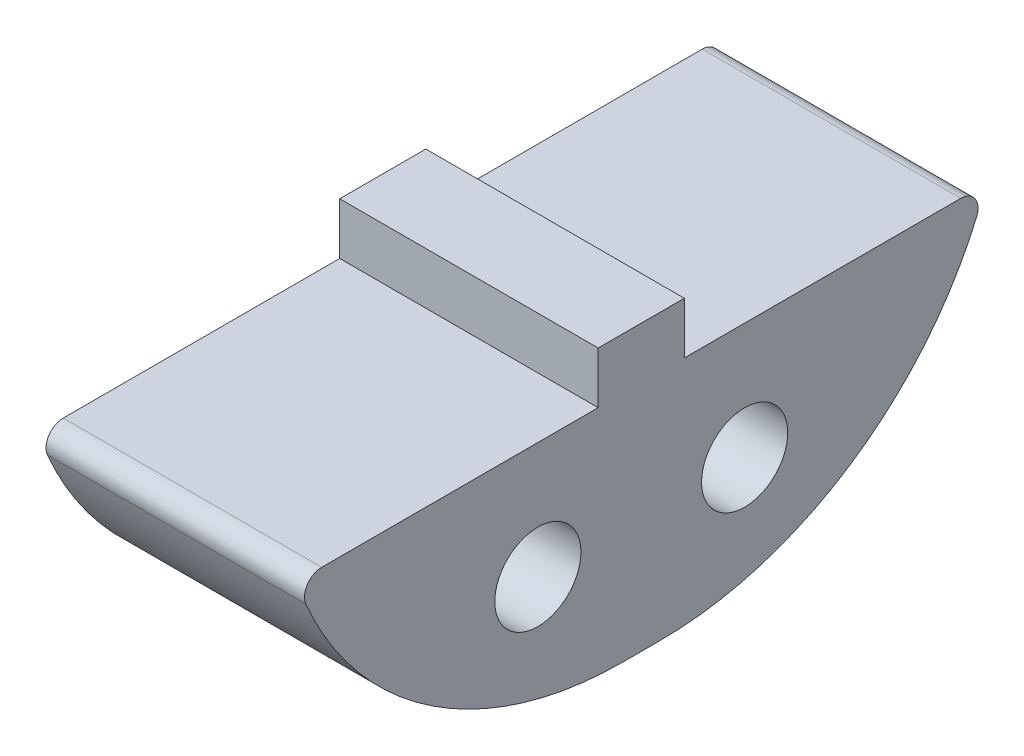
from build123d import *

# Parameters (mm, degrees)
SKETCH1_W           = 30
SKETCH1_H           = 80
BOSS_EXTRUDE1_DEPTH = 27
SKETCH5_W           = 30
SKETCH5_H           = 10
BOSS_EXTRUDE2_DEPTH = 6
SKETCH2_R           = 5
CUT_EXTRUDE1_DEPTH  = 40
FILLET5_R           = 40
FILLET6_R           = 40
FILLET7_R           = 2
FILLET8_R           = 2


with BuildPart() as part:
    # Sketch1 → Boss-Extrude1 (new body)
    with BuildSketch(Plane(origin=(0, 0, 0), x_dir=(1, 0, 0), z_dir=(0, 1, 0))):
        Rectangle(SKETCH1_W, SKETCH1_H)
    extrude(amount=BOSS_EXTRUDE1_DEPTH)

    # Sketch5 → Boss-Extrude2 (add)
    with BuildSketch(Plane(origin=(0, 27, 0), x_dir=(1, 0, 0), z_dir=(0, 1, 0))):
        Rectangle(SKETCH5_W, SKETCH5_H)
    extrude(amount=BOSS_EXTRUDE2_DEPTH)

    # Sketch2 → Cut-Extrude1 (cut)
    with BuildSketch(Plane(origin=(15, 0, 0), x_dir=(0, 0, -1), z_dir=(1, 0, 0))):
        with Locations((-12, 13.5)):
            Circle(SKETCH2_R)
        with Locations(Location((12, 13.5, 0), (0, 0, 180))):
            Circle(SKETCH2_R)
    extrude(amount=-CUT_EXTRUDE1_DEPTH, mode=Mode.SUBTRACT)

    # Fillet5
    # the kernel refuses this fillet: 40 mm, written as the material it takes off along each edge
    with BuildSketch(Plane(origin=(109.571401597, 0, -40), x_dir=(0, 0, 1), z_dir=(-1, 0, 0))) as fillet5_piece_1:
        with BuildLine():
            CenterArc((37.828560639, 40), FILLET5_R, 198.965574989, 71.034425011)
            Line((0, 27), (-0.756571213, 26.74))
            ThreePointArc((-0.756571213, 26.74), (-0.8, 13.5), (-0.8, 0))
            Line((-0.8, 0), (0, -0.8))
            Line((0, -0.8), (37.828560639, -0.8))
            Line((37.828560639, -0.8), (37.828560639, 0))
        make_face()
    extrude(amount=219.142803194, mode=Mode.SUBTRACT)

    # Fillet6
    # the kernel refuses this fillet: 40 mm, written as the material it takes off along each edge
    with BuildSketch(Plane(origin=(-109.571401597, 0, 40), x_dir=(0, 1, 0), z_dir=(1, 0, 0))) as fillet6_piece_1:
        with BuildLine():
            CenterArc((40, -37.828560639), FILLET6_R, 108.965574989, 71.034425011)
            Line((0, -37.828560639), (-0.8, -37.828560639))
            Line((-0.8, -37.828560639), (-0.8, 0))
            Line((-0.8, 0), (0, 0.8))
            ThreePointArc((0, 0.8), (13.5, 0.8), (26.74, 0.756571213))
            Line((26.74, 0.756571213), (27, 0))
        make_face()
    extrude(amount=219.142803194, mode=Mode.SUBTRACT)

    # Fillet7
    fillet7_edges = [part.edges().sort_by_distance(p)[0] for p in [
        (0, 27, -40),
    ]]
    fillet(fillet7_edges, radius=FILLET7_R)

    # Fillet8
    fillet8_edges = [part.edges().sort_by_distance(p)[0] for p in [
        (0, 27, 40),
    ]]
    fillet(fillet8_edges, radius=FILLET8_R)


solid = part.part
